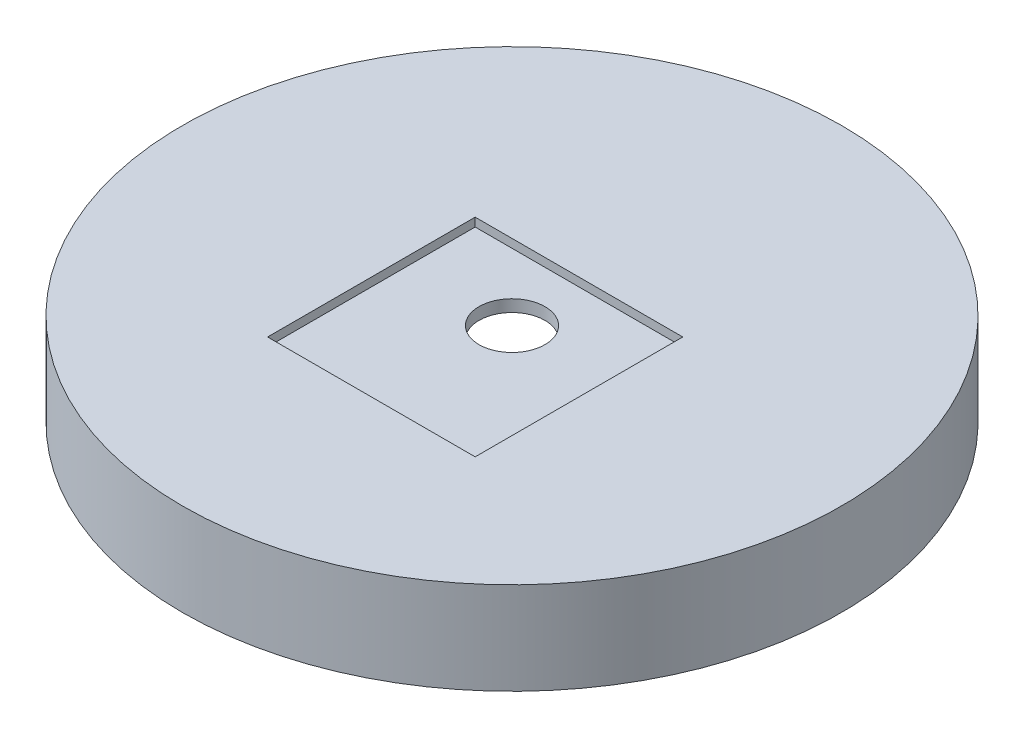
from build123d import *

# Parameters (mm, degrees)
SKETCH5_W          = 15.748
SKETCH5_H          = 15.748
CUT_EXTRUDE1_DEPTH = 6.35


with BuildPart() as part:
    # Sketch3 → Revolve1 (revolve)
    with BuildSketch(Plane.XY):
        Polygon((21, 0), (2.5, 5.442857143), (2.5, 7), (25, 7), (25, 0), align=None)
    revolve(axis=Axis((0, 0, 0), (0, -1, 0)))

    # Sketch5 → Cut-Extrude1 (cut)
    with BuildSketch(Plane(origin=(0, 12.7, 0), x_dir=(1, 0, 0), z_dir=(0, 1, 0))):
        with Locations((0, -2.794)):
            Rectangle(SKETCH5_W, SKETCH5_H)
    extrude(amount=-CUT_EXTRUDE1_DEPTH, mode=Mode.SUBTRACT)


solid = part.part
